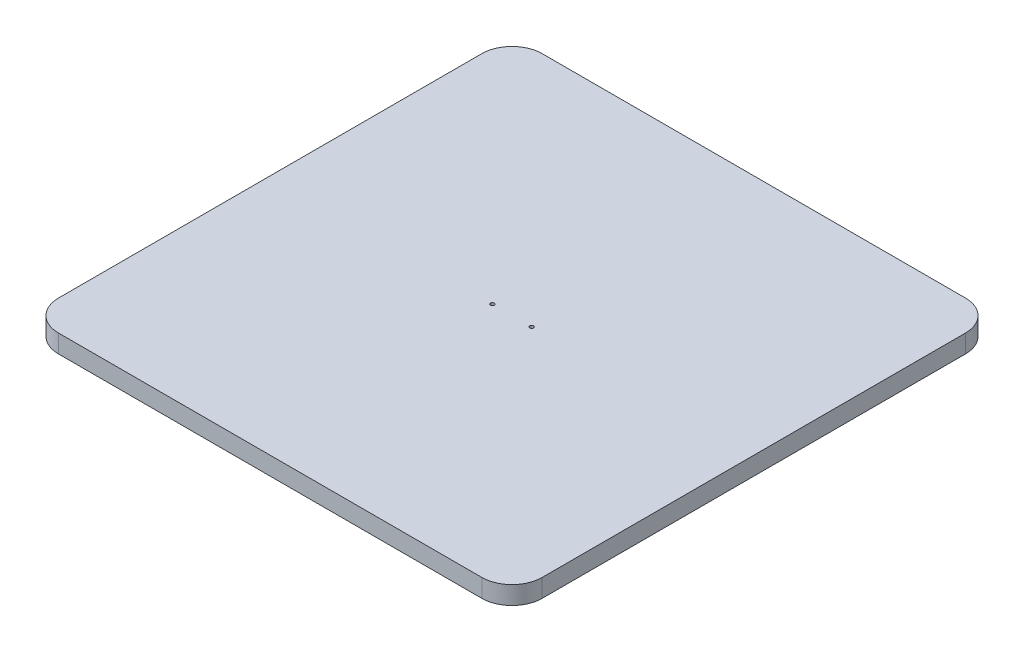
from build123d import *

# Parameters (mm, degrees)
SKETCH1_W           = 160
SKETCH1_H           = 160
BOSS_EXTRUDE1_DEPTH = 6
M1_6_TAPPED_HOLE1_D = 1.25
FILLET1_R           = 10


with BuildPart() as part:
    # Sketch1 → Boss-Extrude1 (new body)
    with BuildSketch(Plane(origin=(0, 0, 0), x_dir=(1, 0, 0), z_dir=(0, 1, 0))):
        Rectangle(SKETCH1_W, SKETCH1_H)
    extrude(amount=BOSS_EXTRUDE1_DEPTH)

    # M1.6 Tapped Hole1 (through all)
    with Locations(Plane(origin=(0, 6, 0), x_dir=(1, 0, 0), z_dir=(0, 1, 0))):
        with Locations((6.5, 0), (-6.5, 0)):
            Hole(M1_6_TAPPED_HOLE1_D / 2)

    # Fillet1
    fillet1_edges = [part.edges().sort_by_distance(p)[0] for p in [
        (-80, 3, 80),
        (80, 3, 80),
        (80, 3, -80),
        (-80, 3, -80),
    ]]
    fillet(fillet1_edges, radius=FILLET1_R)


solid = part.part
